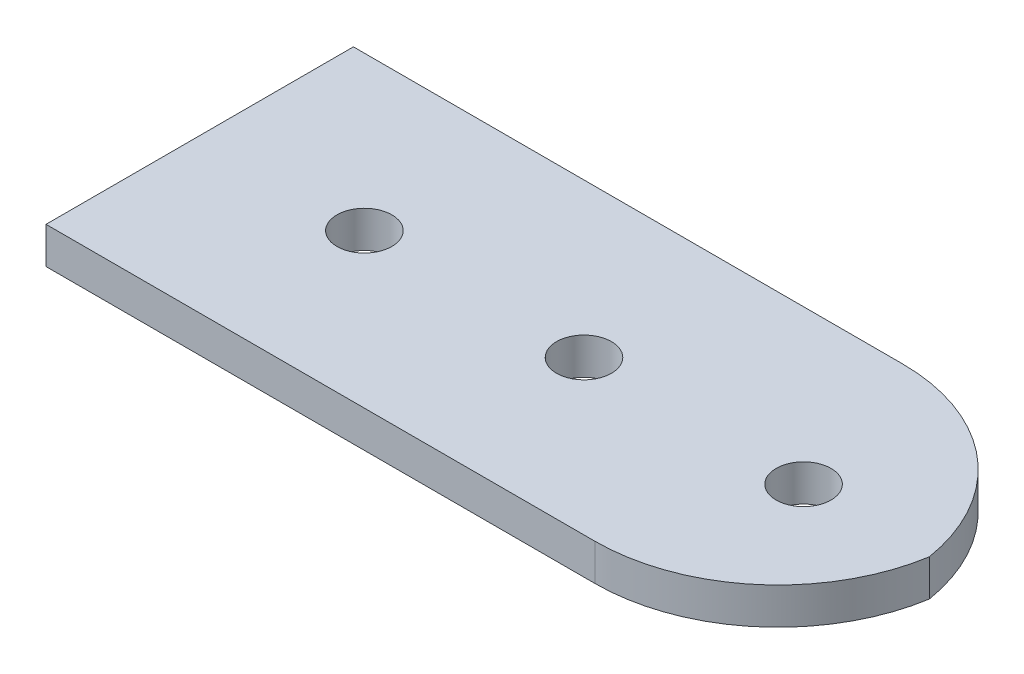
from build123d import *

# Parameters (mm, degrees)
SKETCH1_W           = 40
SKETCH1_H           = 16.8
SKETCH1_R           = 1.5
BOSS_EXTRUDE1_DEPTH = 2
FILLET1_R           = 10


with BuildPart() as part:
    # Sketch1 → Boss-Extrude1 (new body)
    with BuildSketch(Plane(origin=(0, 0, 0), x_dir=(1, 0, 0), z_dir=(0, 1, 0))):
        Rectangle(SKETCH1_W, SKETCH1_H)
        with Locations(Location((-11, 0, 0), (0, 0, 270))):
            Circle(SKETCH1_R, mode=Mode.SUBTRACT)
        with Locations(Location((1, 0, 0), (0, 0, 270))):
            Circle(SKETCH1_R, mode=Mode.SUBTRACT)
        with Locations(Location((13, 0, 0), (0, 0, 270))):
            Circle(SKETCH1_R, mode=Mode.SUBTRACT)
    extrude(amount=BOSS_EXTRUDE1_DEPTH)

    # Fillet1
    # the kernel refuses this fillet: 10 mm, written as the material it takes off along each edge
    with BuildSketch(Plane(origin=(20, -25, -8.4), x_dir=(0, 0, 1), z_dir=(0, 1, 0)), Plane(origin=(20, -25, 8.4), x_dir=(-1, 0, 0), z_dir=(0, 1, 0))) as fillet1_piece_1:
        with BuildLine():
            CenterArc((FILLET1_R, -FILLET1_R), FILLET1_R, 90, 90)
            Line((0, -FILLET1_R), (0, 0))
            Line((0, 0), (FILLET1_R, 0))
        make_face()
    extrude(amount=52, mode=Mode.SUBTRACT)


solid = part.part
